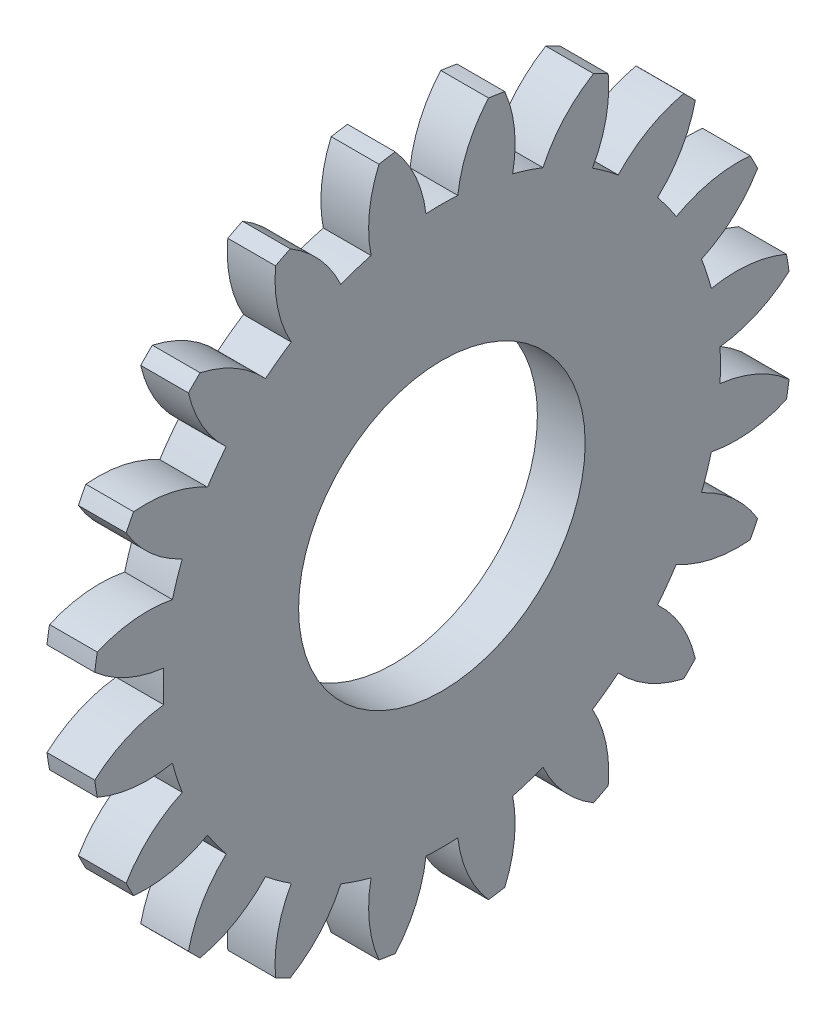
from build123d import *

# Parameters (mm, degrees)
BASPROSKE_W     = 1.5
BASPROSKE_H     = 11
TOOTHCUT_DEPTH  = 16.628499608
TEETHCUTS_COUNT = 20
TEETHCUTS_ANGLE = 342
BORSKE_R        = 4.5
BORE_DEPTH      = 50.0000508


with BuildPart() as part:
    # BasProSke → Base-Revolve (revolve)
    with BuildSketch(Plane(origin=(0, 0, 0), x_dir=(1, 0, 0), z_dir=(0, 1, 0))):
        with Locations((0.75, 5.5)):
            Rectangle(BASPROSKE_W, BASPROSKE_H)
    revolve(axis=Axis((-10, 0, 0), (1, 0, 0)))

    # TooCutSke → ToothCut (cut, through all)
    with BuildSketch(Plane(origin=(0, 0, 0), x_dir=(0, 0, -1), z_dir=(1, 0, 0))):
        with BuildLine():
            ThreePointArc((0.499924007, 8.734705318), (0, 8.749), (-0.499924007, 8.734705318))
            ThreePointArc((-0.499924007, 8.734705318), (-0.824302243, 9.905497836), (-1.485192705, 10.924909509))
            ThreePointArc((-1.485192705, 10.924909509), (0, 11.0254), (1.485192705, 10.924909509))
            ThreePointArc((1.485192705, 10.924909509), (0.824302243, 9.905497836), (0.499924007, 8.734705318))
        make_face()
    toothcut = extrude(amount=TOOTHCUT_DEPTH, mode=Mode.SUBTRACT)

    # TeethCuts: ToothCut ×20 about axis
    teethcuts_axis = Axis((-10, 0, 0), (1, 0, 0))
    for i in range(1, TEETHCUTS_COUNT):
        add(toothcut.rotate(teethcuts_axis, i * TEETHCUTS_ANGLE / (TEETHCUTS_COUNT - 1)), mode=Mode.SUBTRACT)

    # BorSke → Bore (cut, symmetric)
    with BuildSketch(Plane(origin=(0, 0, 0), x_dir=(0, 0, -1), z_dir=(1, 0, 0))):
        Circle(BORSKE_R)
    extrude(amount=BORE_DEPTH, both=True, mode=Mode.SUBTRACT)


solid = part.part
